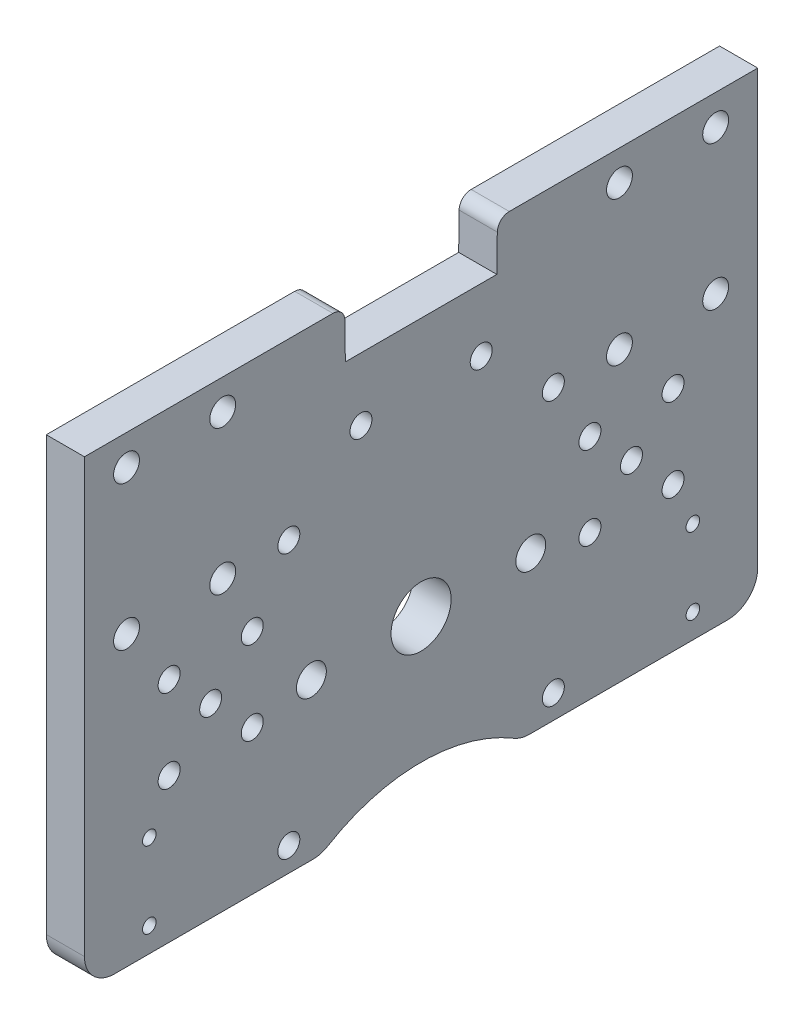
from build123d import *

# Parameters (mm, degrees)
SKETCH1_W                 = 112
SKETCH1_H                 = 77
BOSS_EXTRUDE1_DEPTH       = 6.35
F_6_CLEARANCE_HOLE1_D     = 3.6576
SKETCH5_R                 = 5
CUT_EXTRUDE1_DEPTH        = 77.00870016
F_6_CLEARANCE_HOLE2_D     = 3.6576
F_10_CLEARANCE_HOLE1_D    = 4.9784
F_8_CLEARANCE_HOLE2_D     = 4.3053
CUT_EXTRUDE2_DEPTH        = 77.00870016
F_6_CLEARANCE_HOLE3_D     = 3.6576
FILLET2_R                 = 2
SKETCH25_R                = 30
CUT_EXTRUDE3_DEPTH        = 77.00870016
FILLET1_R                 = 5
TAP_DRILL_FOR_4_40_TAP1_D = 2.2606


with BuildPart() as part:
    # Sketch1 → Boss-Extrude1 (new body)
    with BuildSketch(Plane(origin=(0, 0, 0), x_dir=(0, 0, -1), z_dir=(1, 0, 0))):
        with Locations((0, 12.5)):
            Rectangle(SKETCH1_W, SKETCH1_H)
    extrude(amount=BOSS_EXTRUDE1_DEPTH)

    # #6 Clearance Hole1 (through all)
    with Locations(Plane(origin=(6.35, 0, 0), x_dir=(0, 0, -1), z_dir=(1, 0, 0))):
        with Locations((-22, 22), (22, 22), (22, -22), (-22, -22)):
            Hole(F_6_CLEARANCE_HOLE1_D / 2)

    # Sketch5 → Cut-Extrude1 (cut, through all)
    with BuildSketch(Plane(origin=(6.35, 0, 0), x_dir=(0, 0, -1), z_dir=(1, 0, 0))):
        Circle(SKETCH5_R)
    extrude(amount=-CUT_EXTRUDE1_DEPTH, mode=Mode.SUBTRACT)

    # #6 Clearance Hole2 (through all)
    with Locations(Plane(origin=(6.35, 0, 0), x_dir=(0, 0, -1), z_dir=(1, 0, 0))):
        with Locations((-41.914797213, 11.884797213), (-28.085202787, 11.884797213), (-28.085202787, -1.944797213), (-41.914797213, -1.944797213), (28.085202787, 11.884797213), (28.085202787, -1.944797213), (41.914797213, -1.944797213), (41.914797213, 11.884797213), (-35, 4.97), (35, 4.97)):
            Hole(F_6_CLEARANCE_HOLE2_D / 2)

    # #10 Clearance Hole1 (through all)
    with Locations(Plane.ZY):
        with Locations((18.25, 0), (-18.25, 0)):
            Hole(F_10_CLEARANCE_HOLE1_D / 2)

    # #8 Clearance Hole2 (through all)
    with Locations(Plane(origin=(0, 45.97, 49), x_dir=(0, 0, -1), z_dir=(-1, 0, 0))):
        with Locations((0, 0), (16, 0), (16, 24), (0, 24), (82, 0), (82, 24), (98, 24), (98, 0)):
            Hole(F_8_CLEARANCE_HOLE2_D / 2)

    # Sketch22 → Cut-Extrude2 (cut, through all)
    with BuildSketch(Plane.ZY):
        Polygon((12.7, 51), (-12.7, 51), (-12.6, 42.97), (12.6, 42.97), align=None)
    extrude(amount=-CUT_EXTRUDE2_DEPTH, mode=Mode.SUBTRACT)

    # #6 Clearance Hole3 (through all)
    with Locations(Plane(origin=(0, 32.5052, 10), x_dir=(0, 0, -1), z_dir=(-1, 0, 0))):
        with Locations((0, 0), (20, 0)):
            Hole(F_6_CLEARANCE_HOLE3_D / 2)

    # Fillet2
    fillet2_edges = [part.edges().sort_by_distance(p)[0] for p in [
        (3.175, 51, -12.7),
        (3.175, 51, 12.7),
    ]]
    fillet(fillet2_edges, radius=FILLET2_R)

    # Sketch25 → Cut-Extrude3 (cut, through all)
    with BuildSketch(Plane.ZY):
        with Locations((0, -51)):
            Circle(SKETCH25_R)
    extrude(amount=-CUT_EXTRUDE3_DEPTH, mode=Mode.SUBTRACT)

    # Fillet1
    fillet1_edges = [part.edges().sort_by_distance(p)[0] for p in [
        (3.175, -26, -56),
        (3.175, -26, 56),
        (3.175, -26, -16.583123952),
        (3.175, -26, 16.583123952),
    ]]
    fillet(fillet1_edges, radius=FILLET1_R)

    # Tap Drill for #4-40 Tap1 (through all)
    with Locations(Plane(origin=(0, -21.954, 45.205), x_dir=(0, 0, -1), z_dir=(-1, 0, 0))):
        with Locations((0, 0), (0, -12.7)):
            tap_drill_for_4_40_tap1 = Hole(TAP_DRILL_FOR_4_40_TAP1_D / 2)

    # Mirror1: Tap Drill for #4-40 Tap1 across plane
    add(tap_drill_for_4_40_tap1.mirror(Plane.XY), mode=Mode.SUBTRACT)


solid = part.part
